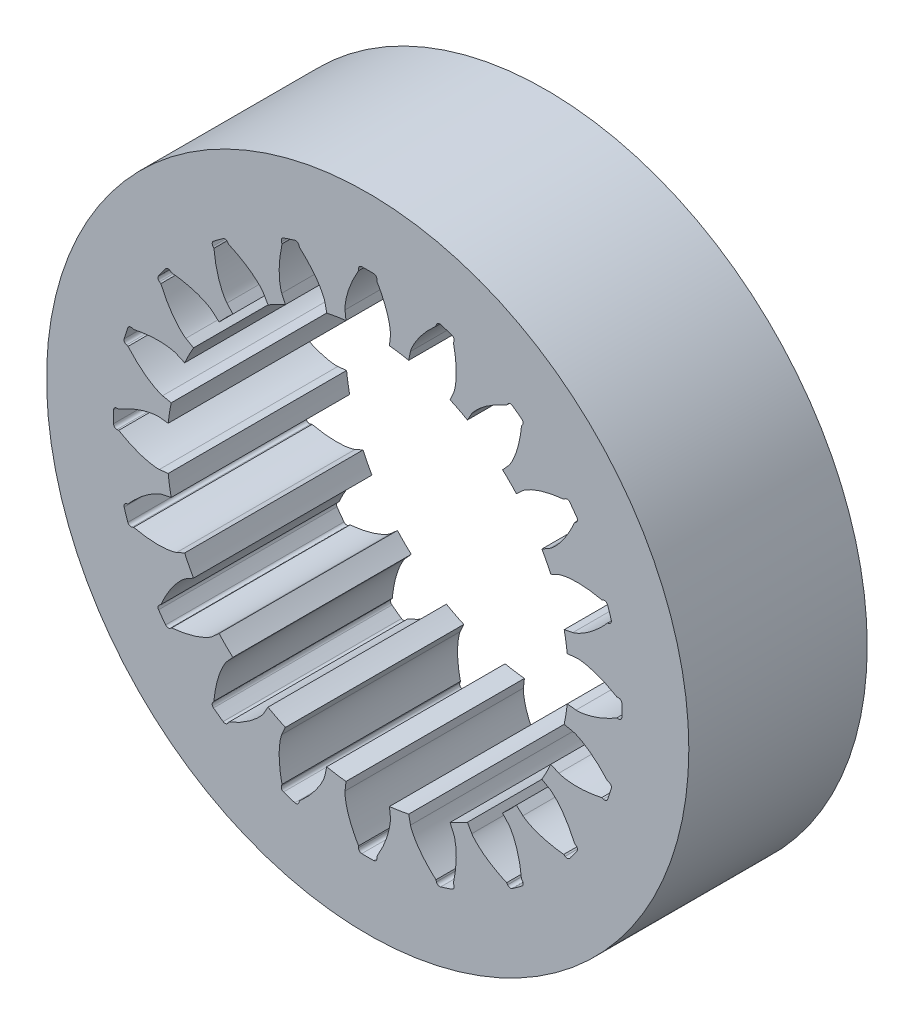
from build123d import *

# Parameters (mm, degrees)
BLANK_SKETCH_R    = 18
BLANK_SKETCH_R_2  = 11.25
BLANK_DEPTH       = 10
TOOTH_SPACE_DEPTH = 28.349588662
TEETH_COUNT       = 20


with BuildPart() as part:
    # Blank Sketch → Blank (new body)
    with BuildSketch(Plane.XY):
        Circle(BLANK_SKETCH_R)
        Circle(BLANK_SKETCH_R_2, mode=Mode.SUBTRACT)
    extrude(amount=BLANK_DEPTH)

    # Tooth Space Sketch → Tooth Space (cut, symmetric)
    with BuildSketch(Plane.XY):
        with BuildLine():
            Line((11.677157164, 1.271307467), (9.94125688, 1.082317719))
            Line((9.94125688, 1.082317719), (9.94125688, -1.082317719))
            Line((9.94125688, -1.082317719), (11.677157164, -1.271307467))
            add(Edge.make_bspline(
                [(11.677157164, -1.271307467), (11.680738593, -1.27164811), (11.690797981, -1.272452496), (11.709869633, -1.273376524), (11.741048763, -1.274035426), (11.780848864, -1.27362662), (11.832348814, -1.271663765), (11.893065838, -1.267506449), (11.959812237, -1.261004877), (12.032418171, -1.251846839), (12.104817529, -1.240868093), (12.176982064, -1.228203441), (12.248801771, -1.2140436), (12.335692478, -1.195070132), (12.439718654, -1.169788535), (12.561001157, -1.1365618), (12.698137613, -1.094546133), (12.837362881, -1.047113449), (12.973885604, -0.996655637), (13.111185846, -0.941348154), (13.243572897, -0.884770399), (13.380319656, -0.821604146), (13.506163519, -0.761057432), (13.646207453, -0.688389487), (13.758956268, -0.628330899), (13.874568323, -0.562285417), (13.930707748, -0.529551056), (13.959342554, -0.512573912)],
                knots=[0, 0, 0, 0, 0, 0.005376749, 0.015083688, 0.02853182, 0.04661014, 0.064854849, 0.092110526, 0.119476176, 0.146842496, 0.174208854, 0.201574956, 0.228941013, 0.256307345, 0.307035032, 0.361767352, 0.416499661, 0.471231937, 0.525964282, 0.580696616, 0.635428982, 0.690161387, 0.744893688, 0.799626082, 0.854358408, 0.909090915, 0.909090915, 0.909090915, 0.909090915, 0.909090915], degree=4))
            Line((13.959342554, -0.512573912), (14.051780203, -0.515968135))
            ThreePointArc((14.051780203, -0.515968135), (14.187201501, -0.465098742), (14.246109195, -0.332975669))
            ThreePointArc((14.246109195, -0.332975669), (14.25, 0), (14.246109195, 0.332975669))
            ThreePointArc((14.246109195, 0.332975669), (14.187201501, 0.465098742), (14.051780203, 0.515968135))
            Line((14.051780203, 0.515968135), (13.959342554, 0.512573912))
            add(Edge.make_bspline(
                [(11.677157164, 1.271307467), (11.680738593, 1.27164811), (11.690797981, 1.272452496), (11.709869633, 1.273376524), (11.741048763, 1.274035426), (11.780848864, 1.27362662), (11.832348814, 1.271663765), (11.893065838, 1.267506449), (11.959812237, 1.261004877), (12.032418171, 1.251846839), (12.104817529, 1.240868093), (12.176982064, 1.228203441), (12.248801771, 1.2140436), (12.335692478, 1.195070132), (12.439718654, 1.169788535), (12.561001157, 1.1365618), (12.698137613, 1.094546133), (12.837362881, 1.047113449), (12.973885604, 0.996655637), (13.111185846, 0.941348154), (13.243572897, 0.884770399), (13.380319656, 0.821604146), (13.506163519, 0.761057432), (13.646207453, 0.688389487), (13.758956268, 0.628330899), (13.874568323, 0.562285417), (13.930707748, 0.529551056), (13.959342554, 0.512573912)],
                knots=[0, 0, 0, 0, 0, 0.005376749, 0.015083688, 0.02853182, 0.04661014, 0.064854849, 0.092110526, 0.119476176, 0.146842496, 0.174208854, 0.201574956, 0.228941013, 0.256307345, 0.307035032, 0.361767352, 0.416499661, 0.471231937, 0.525964282, 0.580696616, 0.635428982, 0.690161387, 0.744893688, 0.799626082, 0.854358408, 0.909090915, 0.909090915, 0.909090915, 0.909090915, 0.909090915], degree=4))
        make_face()
    tooth_space = extrude(amount=TOOTH_SPACE_DEPTH, both=True, mode=Mode.SUBTRACT)

    # Teeth: Tooth Space ×20 about axis
    teeth_axis = Axis((0, 0, -0.50007105), (0, 0, 1))
    for i in range(1, TEETH_COUNT):
        add(tooth_space.rotate(teeth_axis, i * 360 / TEETH_COUNT), mode=Mode.SUBTRACT)


solid = part.part
